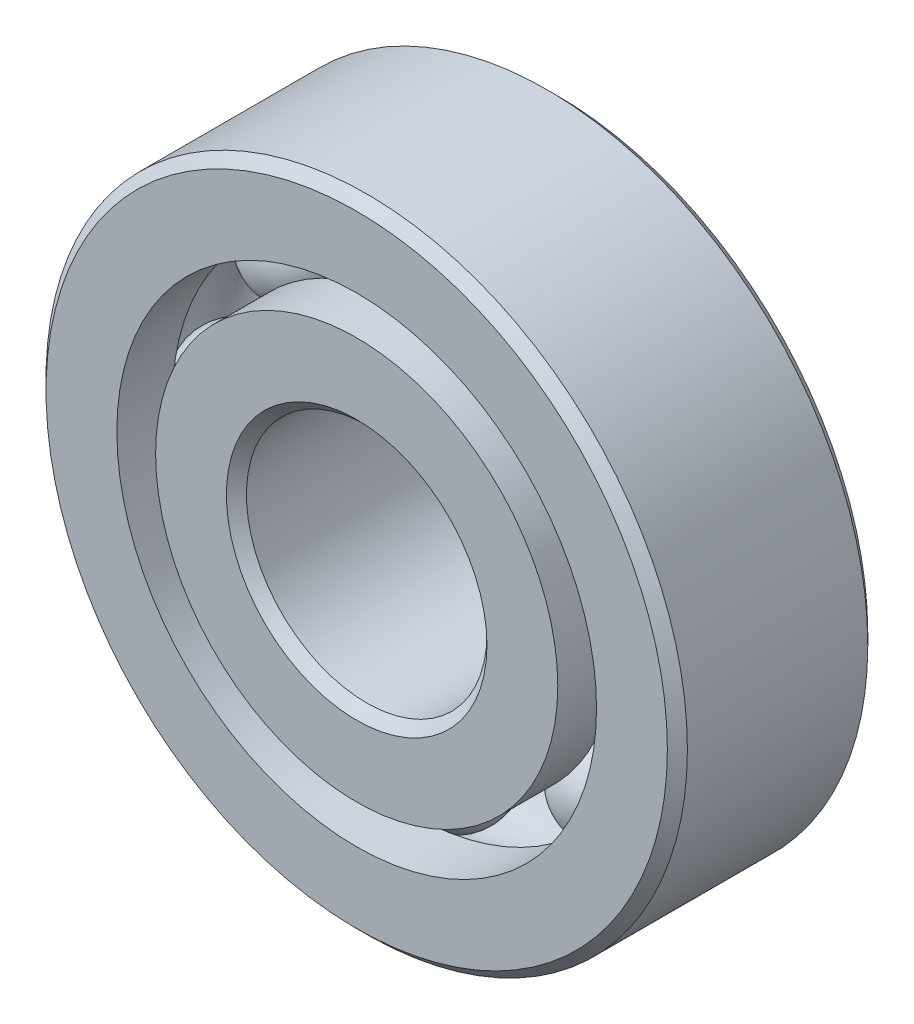
from build123d import *

# Parameters (mm, degrees)
CIRPATTERN1_COUNT = 8


with BuildPart() as part:
    # Sketch1 → Revolve1 (revolve)
    with BuildSketch(Plane(origin=(0, 0, 0), x_dir=(0, 0, -1), z_dir=(1, 0, 0))):
        with BuildLine():
            Line((1.7859375, 6.35), (-1.7859375, 6.35))
            Line((-1.7859375, 6.35), (-1.984375, 6.1515625))
            Line((-1.984375, 6.1515625), (-1.984375, 4.749416209))
            Line((-1.984375, 4.749416209), (-0.881944444, 4.749416209))
            ThreePointArc((-0.881944444, 4.749416209), (0, 5.327457467), (0.881944444, 4.749416209))
            Line((0.881944444, 4.749416209), (1.984375, 4.749416209))
            Line((1.984375, 4.749416209), (1.984375, 6.1515625))
            Line((1.984375, 6.1515625), (1.7859375, 6.35))
        make_face()
    revolve(axis=Axis((0, 0, 1.984375), (0, 0, -1)))


with BuildPart() as body_2:
    # Sketch3 → Revolve3 (revolve)
    with BuildSketch(Plane(origin=(0, 0, 0), x_dir=(0, 0, -1), z_dir=(1, 0, 0))):
        with BuildLine():
            Line((-1.984375, 3.981833791), (-0.881944444, 3.981833791))
            ThreePointArc((-0.881944444, 3.981833791), (0, 3.403792533), (0.881944444, 3.981833791))
            Line((0.881944444, 3.981833791), (1.984375, 3.981833791))
            Line((1.984375, 3.981833791), (1.984375, 2.5796875))
            Line((1.984375, 2.5796875), (1.7859375, 2.38125))
            Line((1.7859375, 2.38125), (-1.7859375, 2.38125))
            Line((-1.7859375, 2.38125), (-1.984375, 2.5796875))
            Line((-1.984375, 2.5796875), (-1.984375, 3.981833791))
        make_face()
    revolve(axis=Axis((0, 0, 1.984375), (0, 0, -1)))


with BuildPart() as body_3:
    # Sketch4 → Revolve4 (revolve)
    with BuildSketch(Plane(origin=(0, 0, 0), x_dir=(0, 0, -1), z_dir=(1, 0, 0))):
        with BuildLine():
            Line((-0.961832467, 4.365625), (0.961832467, 4.365625))
            ThreePointArc((0.961832467, 4.365625), (0, 5.327457467), (-0.961832467, 4.365625))
        make_face()
    revolve(axis=Axis((0, 4.365625, 0.961832467), (0, 0, -1)))


with BuildPart() as cirpattern1_1:
    # CirPattern1: pattern copy
    add(body_3.part.rotate(Axis((0, 0, -1.984375), (0, 0, 1)), 1 * 360 / CIRPATTERN1_COUNT))


with BuildPart() as cirpattern1_2:
    # CirPattern1: pattern copy
    add(body_3.part.rotate(Axis((0, 0, -1.984375), (0, 0, 1)), 2 * 360 / CIRPATTERN1_COUNT))


with BuildPart() as cirpattern1_3:
    # CirPattern1: pattern copy
    add(body_3.part.rotate(Axis((0, 0, -1.984375), (0, 0, 1)), 3 * 360 / CIRPATTERN1_COUNT))


with BuildPart() as cirpattern1_4:
    # CirPattern1: pattern copy
    add(body_3.part.rotate(Axis((0, 0, -1.984375), (0, 0, 1)), 4 * 360 / CIRPATTERN1_COUNT))


with BuildPart() as cirpattern1_5:
    # CirPattern1: pattern copy
    add(body_3.part.rotate(Axis((0, 0, -1.984375), (0, 0, 1)), 5 * 360 / CIRPATTERN1_COUNT))


with BuildPart() as cirpattern1_6:
    # CirPattern1: pattern copy
    add(body_3.part.rotate(Axis((0, 0, -1.984375), (0, 0, 1)), 6 * 360 / CIRPATTERN1_COUNT))


with BuildPart() as cirpattern1_7:
    # CirPattern1: pattern copy
    add(body_3.part.rotate(Axis((0, 0, -1.984375), (0, 0, 1)), 7 * 360 / CIRPATTERN1_COUNT))


solid = Compound([part.part, body_2.part, body_3.part, cirpattern1_1.part, cirpattern1_2.part, cirpattern1_3.part, cirpattern1_4.part, cirpattern1_5.part, cirpattern1_6.part, cirpattern1_7.part])
